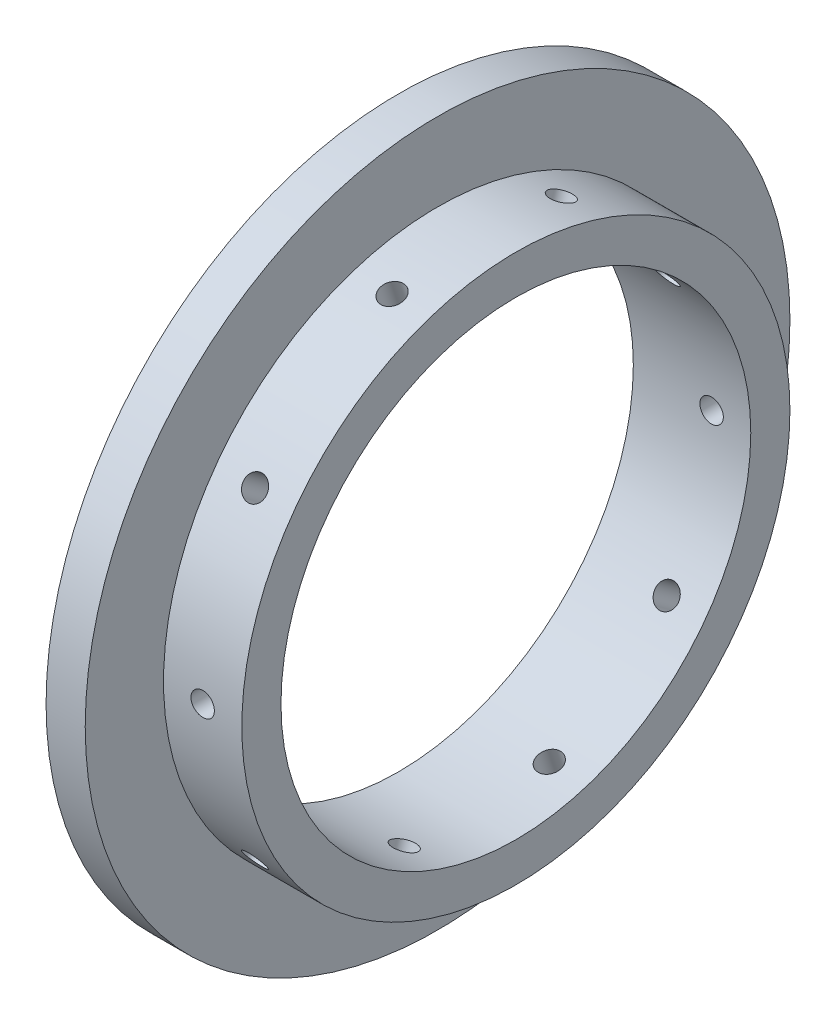
from build123d import *

# Parameters (mm, degrees)
SKETCH1_R           = 57.15
SKETCH1_R_2         = 38.1
BOSS_EXTRUDE1_DEPTH = 6.35
SKETCH2_R           = 44.45
SKETCH2_R_2         = 38.1
BOSS_EXTRUDE2_DEPTH = 12.7
SKETCH4_R           = 1.89865
CUT_EXTRUDE1_DEPTH  = 7.62
CIRPATTERN1_COUNT   = 10


with BuildPart() as part:
    # Sketch1 → Boss-Extrude1 (new body)
    with BuildSketch(Plane(origin=(0, 0, 0), x_dir=(0, 0, -1), z_dir=(1, 0, 0))):
        Circle(SKETCH1_R)
        Circle(SKETCH1_R_2, mode=Mode.SUBTRACT)
    extrude(amount=BOSS_EXTRUDE1_DEPTH)

    # Sketch2 → Boss-Extrude2 (add)
    with BuildSketch(Plane(origin=(6.35, 0, 0), x_dir=(0, 0, -1), z_dir=(1, 0, 0))):
        Circle(SKETCH2_R)
        Circle(SKETCH2_R_2, mode=Mode.SUBTRACT)
    extrude(amount=BOSS_EXTRUDE2_DEPTH)

    # Sketch4 → Cut-Extrude1 (cut)
    with BuildSketch(Plane(origin=(0, 0, -44.45), x_dir=(-1, 0, 0), z_dir=(0, 0, -1))):
        with Locations((-12.7, 0)):
            Circle(SKETCH4_R)
    cut_extrude1 = extrude(amount=-CUT_EXTRUDE1_DEPTH, mode=Mode.SUBTRACT)

    # CirPattern1: Cut-Extrude1 ×10 about axis
    cirpattern1_axis = Axis((0, 0, 0), (1, 0, 0))
    for i in range(1, CIRPATTERN1_COUNT):
        add(cut_extrude1.rotate(cirpattern1_axis, i * 360 / CIRPATTERN1_COUNT), mode=Mode.SUBTRACT)


solid = part.part
